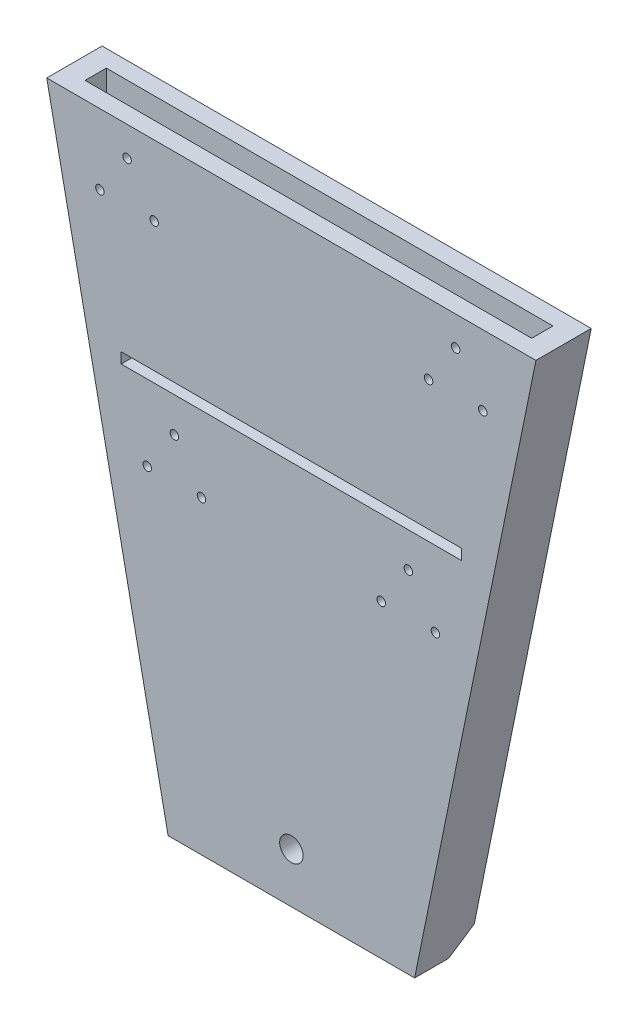
from build123d import *

# Parameters (mm, degrees)
EXTRUDE_1_DEPTH     = 8
CUT_EXTRUDE_1_DEPTH = 8.5
EXTRUDE_2_DEPTH     = 8
EXTRUDE_3_DEPTH     = 10
SKETCH_7_R          = 5.5
CUT_EXTRUDE_2_DEPTH = 22
EXTRUDE_5_DEPTH     = 26
CUT_EXTRUDE_4_DEPTH = 21
CHAMFER_6_SIZE      = 5
CHAMFER_8_SIZE      = 10
SKETCH_13_W         = 210
SKETCH_13_H         = 10
CUT_EXTRUDE_5_DEPTH = 15
SKETCH_14_W         = 160
SKETCH_14_H         = 5
CUT_EXTRUDE_6_DEPTH = 10
SKETCH_16_R         = 2
CUT_EXTRUDE_7_DEPTH = 10
SKETCH_18_W         = 109.386418102
SKETCH_18_H         = 16
EXTRUDE_7_DEPTH     = 2
CHAMFER_10_SIZE     = 2


with BuildPart() as part:
    # 草图1 → 凸台-拉伸1 (new body)
    with BuildSketch(Plane.XY):
        Polygon((-60, 0), (60, 0), (115, 270), (-115, 270), align=None)
    extrude(amount=EXTRUDE_1_DEPTH)

    # 草图2 → 切除-拉伸1 (cut)
    with BuildSketch(Plane.XY.offset(8)):
        with BuildLine():
            Line((0.005000474, 0.310000947), (0, 0.3))
            Line((0, 0.3), (17.48870838, 0.3))
            Line((17.48870838, 0.3), (12.108893566, 26.71))
            Line((12.108893566, 26.71), (0, 26.71))
            ThreePointArc((0, 26.71), (-13.199999763, 13.507499763), (0.005000474, 0.310000947))
        make_face()
    extrude(amount=-CUT_EXTRUDE_1_DEPTH, mode=Mode.SUBTRACT)

    # 草图5 → 凸台-拉伸2 (add)
    with BuildSketch(Plane(origin=(0, 0, 0), x_dir=(-1, 0, 0), z_dir=(0, 0, -1))):
        Polygon((60, 0), (115, 270), (-115, 270), (-60, 0), align=None)
    extrude(amount=EXTRUDE_2_DEPTH)

    # 草图6 → 凸台-拉伸3 (add)
    with BuildSketch(Plane.XY.offset(8)):
        Polygon((-115, 270), (-60, 0), (60, 0), (115, 270), align=None)
    extrude(amount=EXTRUDE_3_DEPTH)

    # 草图7 → 切除-拉伸2 (cut)
    with BuildSketch(Plane.XY.offset(18)):
        with Locations((0, 13.51)):
            Circle(SKETCH_7_R)
    extrude(amount=-CUT_EXTRUDE_2_DEPTH, mode=Mode.SUBTRACT)

    # 草图9 → 凸台-拉伸5 (add)
    with BuildSketch(Plane.XY.offset(18)):
        Polygon((-57.962962963, -10), (-60, 0), (60, 0), (57.962962963, -10), align=None)
    extrude(amount=-EXTRUDE_5_DEPTH)

    # 草图12 → 切除-拉伸4 (cut)
    with BuildSketch(Plane.XY.offset(-8)):
        Polygon((54.693209051, 0), (-54.693209051, 0), (-52.656172014, -10), (52.656172014, -10), align=None)
    extrude(amount=CUT_EXTRUDE_4_DEPTH, mode=Mode.SUBTRACT)

    # 倒角6
    chamfer_6_edges = [part.edges().sort_by_distance(p)[0] for p in [
        (0, 0, -8),
    ]]
    chamfer(chamfer_6_edges, length=CHAMFER_6_SIZE)

    # 倒角8
    chamfer_8_edges = [part.edges().sort_by_distance(p)[0] for p in [
        (55.309567488, -10, -8),
        (-55.309567488, -10, -8),
    ]]
    chamfer(chamfer_8_edges, length=CHAMFER_8_SIZE)

    # 草图13 → 切除-拉伸5 (cut)
    with BuildSketch(Plane(origin=(0, 270, 0), x_dir=(1, 0, 0), z_dir=(0, 1, 0))):
        with Locations((0, -5)):
            Rectangle(SKETCH_13_W, SKETCH_13_H)
    extrude(amount=-CUT_EXTRUDE_5_DEPTH, mode=Mode.SUBTRACT)

    # 草图14 → 切除-拉伸6 (cut)
    with BuildSketch(Plane.XY.offset(18)):
        with Locations((0, 173.51)):
            Rectangle(SKETCH_14_W, SKETCH_14_H)
    extrude(amount=-CUT_EXTRUDE_6_DEPTH, mode=Mode.SUBTRACT)

    # 草图16 → 切除-拉伸7 (cut)
    with BuildSketch(Plane.XY.offset(18)):
        with Locations((-77.25, 256.1425573)):
            Circle(SKETCH_16_R)
        with Locations((-90, 237)):
            Circle(SKETCH_16_R)
        with Locations((-64.5, 237)):
            Circle(SKETCH_16_R)
        with Locations((77.25, 256.1425573)):
            Circle(SKETCH_16_R)
        with Locations((64.5, 237)):
            Circle(SKETCH_16_R)
        with Locations((90, 237)):
            Circle(SKETCH_16_R)
        with Locations((-55, 154.6525573)):
            Circle(SKETCH_16_R)
        with Locations((-42.25, 135.51)):
            Circle(SKETCH_16_R)
        with Locations((55, 154.6525573)):
            Circle(SKETCH_16_R)
        with Locations((42.25, 135.51)):
            Circle(SKETCH_16_R)
        with Locations((67.75, 135.51)):
            Circle(SKETCH_16_R)
        with Locations((-67.75, 135.51)):
            Circle(SKETCH_16_R)
    extrude(amount=-CUT_EXTRUDE_7_DEPTH, mode=Mode.SUBTRACT)

    # 草图18 → 凸台-拉伸7 (add)
    with BuildSketch(Plane.XZ):
        with Locations((0, 5)):
            Rectangle(SKETCH_18_W, SKETCH_18_H)
    extrude(amount=EXTRUDE_7_DEPTH)

    # 倒角10
    chamfer_10_edges = [part.edges().sort_by_distance(p)[0] for p in [
        (0, -2, -3),
    ]]
    chamfer(chamfer_10_edges, length=CHAMFER_10_SIZE - 0.0001)  # a hair under: the kernel refuses the full size


solid = part.part
